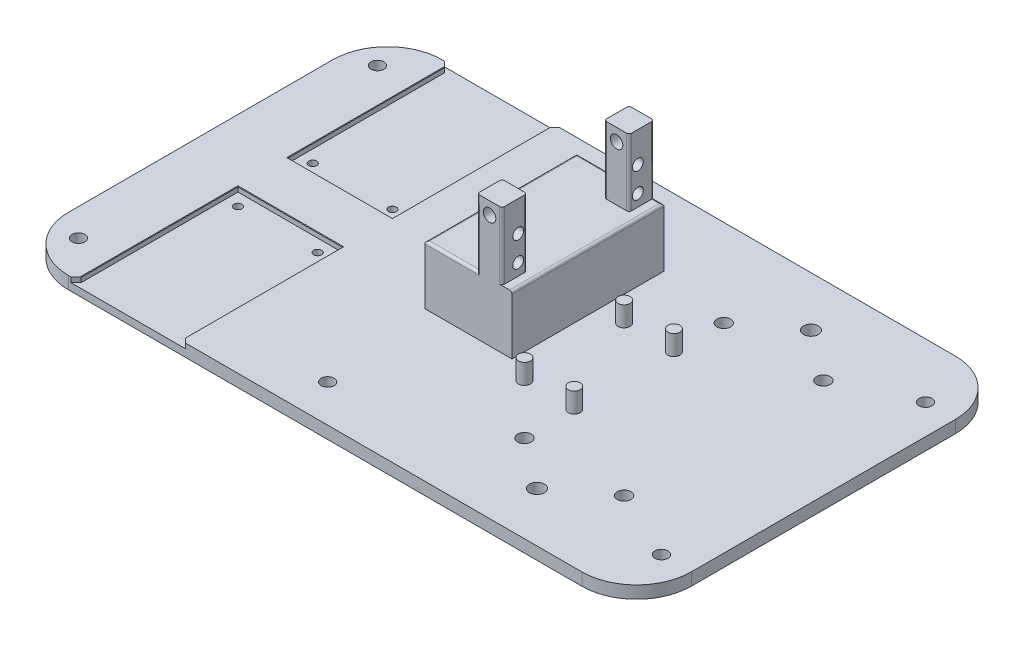
from build123d import *

# Parameters (mm, degrees)
SKETCH_1_R          = 2.6
SKETCH_1_R_2        = 3
SKETCH_1_R_3        = 2.75
EXTRUDE_1_DEPTH     = 5
SKETCH_2_W          = 42
SKETCH_2_H          = 65
CUT_EXTRUDE_1_DEPTH = 2
CHAMFER_1_SIZE      = 0.2
SKETCH_3_R          = 1.6
CUT_EXTRUDE_2_DEPTH = 3
CHAMFER_2_SIZE      = 2
SKETCH_4_R          = 2.4
EXTRUDE_2_DEPTH     = 8
SKETCH_5_W          = 35
SKETCH_5_H          = 61
EXTRUDE_3_DEPTH     = 23.5
SKETCH_7_W          = 35
SKETCH_7_H          = 10
EXTRUDE_4_DEPTH     = 30
SKETCH_8_W          = 4
SKETCH_8_H          = 10
SKETCH_8_W_2        = 21
CUT_EXTRUDE_3_DEPTH = 30
FILLET_1_R          = 1
SKETCH_9_R          = 2.2
CUT_EXTRUDE_4_DEPTH = 158.870991636
SKETCH_10_R         = 2.5
SKETCH_10_W         = 10
SKETCH_10_H         = 3
CUT_EXTRUDE_5_DEPTH = 165.764225486


with BuildPart() as part:
    # 草图1 → 凸台-拉伸1 (new body)
    with BuildSketch(Plane(origin=(0, 0, 0), x_dir=(1, 0, 0), z_dir=(0, 1, 0))):
        with BuildLine():
            Line((103, 75), (95, 75))
            Line((95, 75), (55, 75))
            Line((55, 75), (-103, 75))
            ThreePointArc((-103, 75), (-118.556349186, 68.556349186), (-125, 53))
            Line((-125, 53), (-125, -53))
            ThreePointArc((-125, -53), (-118.556349186, -68.556349186), (-103, -75))
            Line((-103, -75), (55, -75))
            Line((55, -75), (95, -75))
            Line((95, -75), (103, -75))
            ThreePointArc((103, -75), (118.556349186, -68.556349186), (125, -53))
            Line((125, -53), (125, 53))
            ThreePointArc((125, 53), (118.556349186, 68.556349186), (103, 75))
        make_face()
        with Locations(Location((-114, 60, 0), (0, 0, 270))):
            Circle(SKETCH_1_R, mode=Mode.SUBTRACT)
        with Locations(Location((-14, 60, 0), (0, 0, 270))):
            Circle(SKETCH_1_R, mode=Mode.SUBTRACT)
        with Locations(Location((113, 53, 0), (0, 0, 270))):
            Circle(SKETCH_1_R, mode=Mode.SUBTRACT)
        with Locations(Location((-114, -60, 0), (0, 0, 270))):
            Circle(SKETCH_1_R, mode=Mode.SUBTRACT)
        with Locations(Location((-14, -60, 0), (0, 0, 270))):
            Circle(SKETCH_1_R, mode=Mode.SUBTRACT)
        with Locations(Location((113, -53, 0), (0, 0, 270))):
            Circle(SKETCH_1_R, mode=Mode.SUBTRACT)
        with Locations(Location((65, -55, 0), (0, 0, 270))):
            Circle(SKETCH_1_R_2, mode=Mode.SUBTRACT)
        with Locations(Location((65, 55, 0), (0, 0, 90))):
            Circle(SKETCH_1_R_2, mode=Mode.SUBTRACT)
        with Locations(Location((45, -40, 0), (0, 0, 270))):
            Circle(SKETCH_1_R_3, mode=Mode.SUBTRACT)
        with Locations(Location((85, -40, 0), (0, 0, 270))):
            Circle(SKETCH_1_R_3, mode=Mode.SUBTRACT)
        with Locations(Location((85, 40, 0), (0, 0, 90))):
            Circle(SKETCH_1_R_3, mode=Mode.SUBTRACT)
        with Locations(Location((45, 40, 0), (0, 0, 90))):
            Circle(SKETCH_1_R_3, mode=Mode.SUBTRACT)
    extrude(amount=EXTRUDE_1_DEPTH)

    # 草图2 → 切除-拉伸1 (cut)
    with BuildSketch(Plane(origin=(0, 5, 0), x_dir=(1, 0, 0), z_dir=(0, 1, 0))):
        with Locations((-79, -42.5)):
            Rectangle(SKETCH_2_W, SKETCH_2_H)
        with Locations((-79, 42.5)):
            Rectangle(SKETCH_2_W, SKETCH_2_H)
    extrude(amount=-CUT_EXTRUDE_1_DEPTH, mode=Mode.SUBTRACT)

    # 倒角1
    chamfer_1_edges = [part.edges().sort_by_distance(p)[0] for p in [
        (-58, 5, 42.5),
        (-79, 5, 10),
        (-100, 5, -42.5),
        (-79, 5, -10),
        (-58, 5, -42.5),
        (-100, 5, 42.5),
    ]]
    chamfer(chamfer_1_edges, length=CHAMFER_1_SIZE)

    # 草图3 → 切除-拉伸2 (cut)
    with BuildSketch(Plane(origin=(0, 3, 0), x_dir=(1, 0, 0), z_dir=(0, 1, 0))):
        with Locations(Location((-95, 15, 0), (0, 0, 270))):
            Circle(SKETCH_3_R)
        with Locations(Location((-63, 15, 0), (0, 0, 270))):
            Circle(SKETCH_3_R)
        with Locations(Location((-63, -15, 0), (0, 0, 90))):
            Circle(SKETCH_3_R)
        with Locations(Location((-95, -15, 0), (0, 0, 90))):
            Circle(SKETCH_3_R)
    extrude(amount=-CUT_EXTRUDE_2_DEPTH, mode=Mode.SUBTRACT)

    # 倒角2
    chamfer_2_edges = [part.edges().sort_by_distance(p)[0] for p in [
        (-100, 3.9, -75),
        (-58, 3.9, -75),
        (-58, 3.9, 75),
        (-100, 3.9, 75),
    ]]
    chamfer(chamfer_2_edges, length=CHAMFER_2_SIZE)

    # 草图4 → 凸台-拉伸2 (add)
    with BuildSketch(Plane(origin=(0, 5, 0), x_dir=(1, 0, 0), z_dir=(0, 1, 0))):
        with Locations(Location((25, 20, 0), (0, 0, 270))):
            Circle(SKETCH_4_R)
        with Locations(Location((45, 20, 0), (0, 0, 270))):
            Circle(SKETCH_4_R)
        with Locations(Location((45, -20, 0), (0, 0, 270))):
            Circle(SKETCH_4_R)
        with Locations(Location((25, -20, 0), (0, 0, 270))):
            Circle(SKETCH_4_R)
    extrude(amount=EXTRUDE_2_DEPTH)

    # 草图5 → 凸台-拉伸3 (add)
    with BuildSketch(Plane(origin=(0, 5, 0), x_dir=(1, 0, 0), z_dir=(0, 1, 0))):
        with Locations((-2.5, 15.5)):
            Rectangle(SKETCH_5_W, SKETCH_5_H)
    extrude(amount=EXTRUDE_3_DEPTH)

    # 草图7 → 凸台-拉伸4 (add)
    with BuildSketch(Plane(origin=(0, 28.5, 0), x_dir=(1, 0, 0), z_dir=(0, 1, 0))):
        with Locations((-2.5, 41)):
            Rectangle(SKETCH_7_W, SKETCH_7_H)
        with Locations((-2.5, -10)):
            Rectangle(SKETCH_7_W, SKETCH_7_H)
    extrude(amount=EXTRUDE_4_DEPTH)

    # 草图8 → 切除-拉伸3 (cut)
    with BuildSketch(Plane(origin=(0, 58.5, 0), x_dir=(1, 0, 0), z_dir=(0, 1, 0))):
        with Locations((13, 41)):
            Rectangle(SKETCH_8_W, SKETCH_8_H)
        with Locations((-9.5, 41)):
            Rectangle(SKETCH_8_W_2, SKETCH_8_H)
        with Locations((13, -10)):
            Rectangle(SKETCH_8_W, SKETCH_8_H)
        with Locations((-9.5, -10)):
            Rectangle(SKETCH_8_W_2, SKETCH_8_H)
    extrude(amount=-CUT_EXTRUDE_3_DEPTH, mode=Mode.SUBTRACT)

    # 圆角1
    # the kernel refuses this fillet: 1 mm, written as the material it takes off along each edge
    with BuildSketch(Plane(origin=(17.5, 28.5, -46), x_dir=(0, -1, 0), z_dir=(-1, 0, 0))) as fillet_1_piece_1:
        with BuildLine():
            CenterArc((FILLET_1_R, FILLET_1_R), FILLET_1_R, 180, 90)
            Line((0, FILLET_1_R), (0, 0))
            Line((0, 0), (FILLET_1_R, 0))
        make_face()
    extrude(amount=6.5, mode=Mode.SUBTRACT)
    with BuildSketch(Plane(origin=(11, 61, -46), x_dir=(-1, 0, 0), z_dir=(0, -1, 0)), Plane(origin=(1, 61, 5), x_dir=(0, 0, 1), z_dir=(0, -1, 0)), Plane(origin=(11, 61, 5), x_dir=(-1, 0, 0), z_dir=(0, -1, 0)), Plane(origin=(11, 61, 15), x_dir=(0, 0, -1), z_dir=(0, -1, 0))) as fillet_1_piece_2:
        with BuildLine():
            CenterArc((FILLET_1_R, -FILLET_1_R), FILLET_1_R, 90, 90)
            Line((0, -FILLET_1_R), (0, 0))
            Line((0, 0), (FILLET_1_R, 0))
        make_face()
    extrude(amount=32.5, mode=Mode.SUBTRACT)
    with BuildSketch(Plane(origin=(1, 61, -46), x_dir=(1, 0, 0), z_dir=(0, -1, 0)), Plane(origin=(1, 61, -36), x_dir=(0, 0, -1), z_dir=(0, -1, 0)), Plane(origin=(11, 61, -36), x_dir=(-1, 0, 0), z_dir=(0, -1, 0)), Plane(origin=(1, 61, 15), x_dir=(0, 0, -1), z_dir=(0, -1, 0))) as fillet_1_piece_3:
        with BuildLine():
            CenterArc((FILLET_1_R, FILLET_1_R), FILLET_1_R, 180, 90)
            Line((0, FILLET_1_R), (0, 0))
            Line((0, 0), (FILLET_1_R, 0))
        make_face()
    extrude(amount=32.5, mode=Mode.SUBTRACT)
    with BuildSketch(Plane(origin=(-22.5, 28.5, -46), x_dir=(0, -1, 0), z_dir=(1, 0, 0))) as fillet_1_piece_4:
        with BuildLine():
            CenterArc((FILLET_1_R, -FILLET_1_R), FILLET_1_R, 90, 90)
            Line((0, -FILLET_1_R), (0, 0))
            Line((0, 0), (FILLET_1_R, 0))
        make_face()
    extrude(amount=23.5, mode=Mode.SUBTRACT)
    with BuildSketch(Plane(origin=(15, 28.5, -48.5), x_dir=(-1, 0, 0), z_dir=(0, 0, 1)), Plane(origin=(-20, 28.5, 17.5), x_dir=(1, 0, 0), z_dir=(0, 0, -1))) as fillet_1_piece_5:
        with BuildLine():
            CenterArc((FILLET_1_R, FILLET_1_R), FILLET_1_R, 180, 90)
            Line((0, FILLET_1_R), (0, 0))
            Line((0, 0), (FILLET_1_R, 0))
        make_face()
    extrude(amount=66, mode=Mode.SUBTRACT)
    with BuildSketch(Plane(origin=(1, 28.5, 15), x_dir=(0, 0, -1), z_dir=(-1, 0, 0))) as fillet_1_piece_6:
        with BuildLine():
            CenterArc((FILLET_1_R, FILLET_1_R), FILLET_1_R, 180, 90)
            Line((0, FILLET_1_R), (0, 0))
            Line((0, 0), (FILLET_1_R, 0))
        make_face()
    extrude(amount=23.5, mode=Mode.SUBTRACT)
    with BuildSketch(Plane(origin=(17.5, 28.5, -46), x_dir=(0, -1, 0), z_dir=(-1, 0, 0))) as fillet_1_piece_7a_section:
        with BuildLine():
            CenterArc((FILLET_1_R, FILLET_1_R), FILLET_1_R, 180, 90)
            Line((0, FILLET_1_R), (0, 0))
            Line((0, 0), (FILLET_1_R, 0))
        make_face()
    fillet_1_piece_7a = extrude(amount=9, mode=Mode.PRIVATE)
    fillet_1_piece_7a = split(fillet_1_piece_7a, bisect_by=Plane(origin=(11, 28.273604886, -45.773604886), z_dir=(-1, 0, 0)), keep=Keep.TOP, mode=Mode.PRIVATE)
    with BuildSketch(Plane(origin=(11, 61, -46), x_dir=(-1, 0, 0), z_dir=(0, -1, 0))) as fillet_1_piece_7b_section:
        with BuildLine():
            CenterArc((FILLET_1_R, -FILLET_1_R), FILLET_1_R, 90, 90)
            Line((0, -FILLET_1_R), (0, 0))
            Line((0, 0), (FILLET_1_R, 0))
        make_face()
    fillet_1_piece_7b = extrude(amount=35, mode=Mode.PRIVATE)
    fillet_1_piece_7b = split(fillet_1_piece_7b, bisect_by=Plane(origin=(10.773604886, 28.5, -45.773604886), z_dir=(0, -1, 0)), keep=Keep.TOP, mode=Mode.PRIVATE)
    fillet_1_piece_7 = fillet_1_piece_7a & fillet_1_piece_7b
    add(fillet_1_piece_7, mode=Mode.SUBTRACT)
    with BuildSketch(Plane(origin=(1, 61, -46), x_dir=(1, 0, 0), z_dir=(0, -1, 0))) as fillet_1_piece_8a_section:
        with BuildLine():
            CenterArc((FILLET_1_R, FILLET_1_R), FILLET_1_R, 180, 90)
            Line((0, FILLET_1_R), (0, 0))
            Line((0, 0), (FILLET_1_R, 0))
        make_face()
    fillet_1_piece_8a = extrude(amount=35, mode=Mode.PRIVATE)
    fillet_1_piece_8a = split(fillet_1_piece_8a, bisect_by=Plane(origin=(1.226395114, 28.5, -45.773604886), z_dir=(0, -1, 0)), keep=Keep.TOP, mode=Mode.PRIVATE)
    with BuildSketch(Plane(origin=(-22.5, 28.5, -46), x_dir=(0, -1, 0), z_dir=(1, 0, 0))) as fillet_1_piece_8b_section:
        with BuildLine():
            CenterArc((FILLET_1_R, -FILLET_1_R), FILLET_1_R, 90, 90)
            Line((0, -FILLET_1_R), (0, 0))
            Line((0, 0), (FILLET_1_R, 0))
        make_face()
    fillet_1_piece_8b = extrude(amount=26, mode=Mode.PRIVATE)
    fillet_1_piece_8b = split(fillet_1_piece_8b, bisect_by=Plane(origin=(1, 28.273604886, -45.773604886), z_dir=(1, 0, 0)), keep=Keep.TOP, mode=Mode.PRIVATE)
    fillet_1_piece_8 = fillet_1_piece_8a & fillet_1_piece_8b
    add(fillet_1_piece_8, mode=Mode.SUBTRACT)
    with BuildSketch(Plane(origin=(3.5, 28.5, 15), x_dir=(0, 0, -1), z_dir=(-1, 0, 0))) as fillet_1_piece_9a_section:
        with BuildLine():
            CenterArc((FILLET_1_R, FILLET_1_R), FILLET_1_R, 180, 90)
            Line((0, FILLET_1_R), (0, 0))
            Line((0, 0), (FILLET_1_R, 0))
        make_face()
    fillet_1_piece_9a = extrude(amount=26, mode=Mode.PRIVATE)
    fillet_1_piece_9a = split(fillet_1_piece_9a, bisect_by=Plane(origin=(1, 28.273604886, 14.773604886), z_dir=(1, 0, 0)), keep=Keep.TOP, mode=Mode.PRIVATE)
    with BuildSketch(Plane(origin=(1, 61, 15), x_dir=(0, 0, -1), z_dir=(0, -1, 0))) as fillet_1_piece_9b_section:
        with BuildLine():
            CenterArc((FILLET_1_R, FILLET_1_R), FILLET_1_R, 180, 90)
            Line((0, FILLET_1_R), (0, 0))
            Line((0, 0), (FILLET_1_R, 0))
        make_face()
    fillet_1_piece_9b = extrude(amount=35, mode=Mode.PRIVATE)
    fillet_1_piece_9b = split(fillet_1_piece_9b, bisect_by=Plane(origin=(1.226395114, 28.5, 14.773604886), z_dir=(0, -1, 0)), keep=Keep.TOP, mode=Mode.PRIVATE)
    fillet_1_piece_9 = fillet_1_piece_9a & fillet_1_piece_9b
    add(fillet_1_piece_9, mode=Mode.SUBTRACT)

    # 草图9 → 切除-拉伸4 (cut, through all)
    with BuildSketch(Plane.ZY.offset(-1)):
        with Locations((-39.5, 43.3)):
            Circle(SKETCH_9_R)
        with Locations((-39.5, 33.3)):
            Circle(SKETCH_9_R)
        with Locations((8.5, 43.3)):
            Circle(SKETCH_9_R)
        with Locations((8.5, 33.3)):
            Circle(SKETCH_9_R)
    extrude(amount=-CUT_EXTRUDE_4_DEPTH, mode=Mode.SUBTRACT)

    # 草图10 → 切除-拉伸5 (cut, through all)
    with BuildSketch(Plane.XY.offset(15)):
        with Locations((6, 50.5)):
            Circle(SKETCH_10_R)
        with Locations((6, 57)):
            Rectangle(SKETCH_10_W, SKETCH_10_H)
    extrude(amount=-CUT_EXTRUDE_5_DEPTH, mode=Mode.SUBTRACT)


solid = part.part
